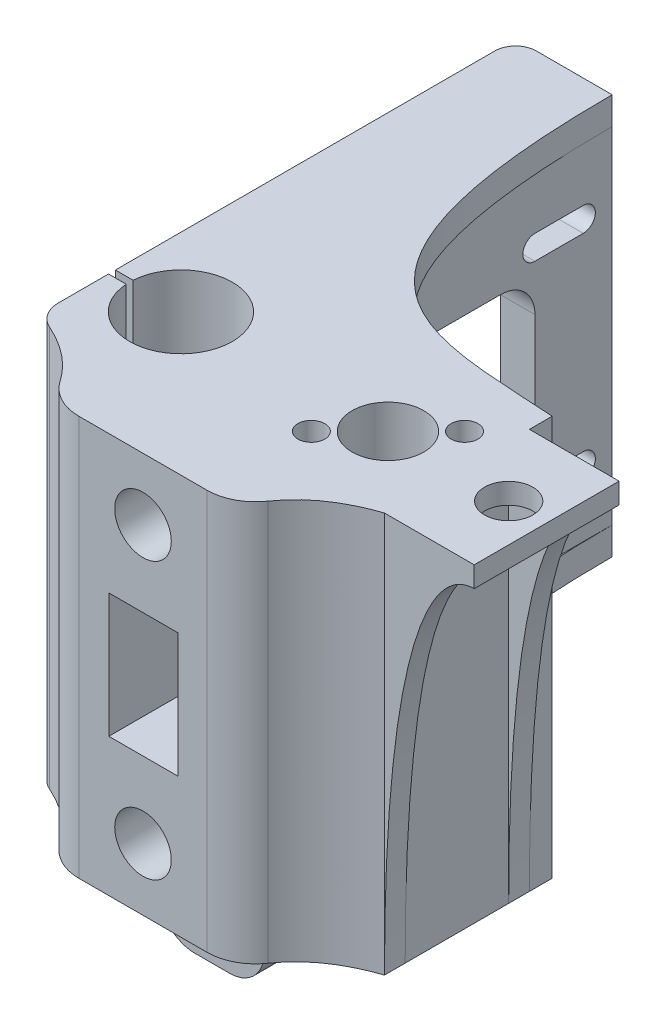
from build123d import *

# Parameters (mm, degrees)
SKETCH1_W                      = 50
SKETCH1_H                      = 21
BOSS_EXTRUDE1_DEPTH            = 58
SKETCH3_R                      = 7.45
CUT_EXTRUDE1_DEPTH             = 24
CUT_EXTRUDE2_REACH             = 66.025
SKETCH4_R                      = 5.2
CUT_EXTRUDE3_START             = -24
SKETCH5_R                      = 7.45
CUT_EXTRUDE3_DEPTH             = 24
CUT_EXTRUDE4_REACH             = 66.025
SKETCH6_R                      = 4.5
SKETCH9_W                      = 5
SKETCH9_H                      = 58
BOSS_EXTRUDE3_DEPTH            = 48
CUT_EXTRUDE7_REACH             = 94.018
BOSS_EXTRUDE4_START            = -4
BOSS_EXTRUDE4_DEPTH            = 4
SKETCH19_R                     = 1.95
CUT_EXTRUDE11_DEPTH            = 10
CUT_EXTRUDE12_DEPTH            = 87.088617298
CUT_EXTRUDE12_DEPTH_BACK       = 87.088617298
SKETCH20_W                     = 5.527864045
SKETCH20_H                     = 1
BOSS_EXTRUDE5_DEPTH            = 13
CUT_EXTRUDE13_START            = -21
CUT_EXTRUDE13_DEPTH            = 21
CUT_EXTRUDE14_REACH            = 90.833
SKETCH23_R                     = 3.5
BOSS_EXTRUDE7_DEPTH            = 11
CUT_EXTRUDE15_REACH            = 98.074
SKETCH26_R                     = 3.5
CUT_EXTRUDE16_DEPTH            = 15.1
SKETCH29_W                     = 50
SKETCH29_H                     = 58
BOSS_EXTRUDE8_DEPTH            = 10
CUT_EXTRUDE17_DEPTH            = 80
FILLET3_R                      = 7
FILLET5_R                      = 7
FILLET6_R                      = 4
SKETCH31_W                     = 36
SKETCH31_H                     = 50.133464381
BOSS_EXTRUDE9_DEPTH            = 3.31
CUT_EXTRUDE8_DEPTH             = 98.82126575
CUT_EXTRUDE8_DEPTH_BACK        = 21
SKETCH7_R                      = 4.1
CUT_EXTRUDE5_REACH             = 99.821
SKETCH8_W                      = 10
SKETCH8_H                      = 18
CUT_EXTRUDE5_DIRECTION_2_DEPTH = 98.82126575
FILLET7_R                      = 5


# Read off the part's stored shape, not the designer's step: Boss-Extrude4
with BuildPart() as part:
    # Sketch1 → Boss-Extrude1 (new body)
    with BuildSketch(Plane(origin=(0, 0, 0), x_dir=(1, 0, 0), z_dir=(0, 1, 0))):
        Rectangle(SKETCH1_W, SKETCH1_H)
    extrude(amount=BOSS_EXTRUDE1_DEPTH)

    # Sketch3 → Cut-Extrude1 (cut)
    with BuildSketch(Plane(origin=(0, 58, 0), x_dir=(1, 0, 0), z_dir=(0, 1, 0))):
        with Locations(Location((-15, 0, 0), (0, 0, 270))):
            Circle(SKETCH3_R)
    extrude(amount=-CUT_EXTRUDE1_DEPTH, mode=Mode.SUBTRACT)

    # Sketch4 → Cut-Extrude2 (cut, up to next)
    with BuildSketch(Plane(origin=(0, 58, 0), x_dir=(1, 0, 0), z_dir=(0, 1, 0)), mode=Mode.PRIVATE) as cut_extrude2_sk1:
        with Locations(Location((15, 0, 0), (0, 0, 270))):
            Circle(SKETCH4_R)
    cut_extrude2_tool1 = extrude(cut_extrude2_sk1.sketch, amount=-CUT_EXTRUDE2_REACH, mode=Mode.PRIVATE) & part.part
    add(cut_extrude2_tool1.solids().sort_by_distance((15, 58, 0))[0], mode=Mode.SUBTRACT)

    # Sketch5 → Cut-Extrude3 (cut)
    with BuildSketch(Plane.XZ.offset(CUT_EXTRUDE3_START)):
        with Locations(Location((-15, 0, 0), (0, 0, 90))):
            Circle(SKETCH5_R)
    extrude(amount=CUT_EXTRUDE3_DEPTH, mode=Mode.SUBTRACT)

    # Sketch6 → Cut-Extrude4 (cut, up to next)
    with BuildSketch(Plane.XZ, mode=Mode.PRIVATE) as cut_extrude4_sk1:
        with Locations(Location((-15, 0, 0), (0, 0, 270))):
            Circle(SKETCH6_R)
    cut_extrude4_tool1 = extrude(cut_extrude4_sk1.sketch, amount=-CUT_EXTRUDE4_REACH, mode=Mode.PRIVATE) & part.part
    add(cut_extrude4_tool1.solids().sort_by_distance((-15, 0, 0))[0], mode=Mode.SUBTRACT)

    # Sketch9 → Boss-Extrude3 (add)
    with BuildSketch(Plane(origin=(0, 0, -10.5), x_dir=(-1, 0, 0), z_dir=(0, 0, -1))):
        with Locations((13.5, 29)):
            Rectangle(SKETCH9_W, SKETCH9_H)
    extrude(amount=BOSS_EXTRUDE3_DEPTH)

    # Sketch10 → Cut-Extrude7 (cut, up to next)
    with BuildSketch(Plane.ZY.offset(16), mode=Mode.PRIVATE) as cut_extrude7_sk1:
        with BuildLine():
            Line((-47.310698145, 46.2), (-54.310698145, 46.2))
            ThreePointArc((-54.310698145, 46.2), (-56.060698145, 44.45), (-54.310698145, 42.7))
            Line((-54.310698145, 42.7), (-47.310698145, 42.7))
            ThreePointArc((-47.310698145, 42.7), (-45.560698145, 44.45), (-47.310698145, 46.2))
        make_face()
    cut_extrude7_tool1 = extrude(cut_extrude7_sk1.sketch, amount=-CUT_EXTRUDE7_REACH, mode=Mode.PRIVATE) & part.part
    # Sketch10 → Cut-Extrude7 (cut, up to next)
    with BuildSketch(Plane.ZY.offset(16), mode=Mode.PRIVATE) as cut_extrude7_sk2:
        with BuildLine():
            Line((-42.310698145, 17), (-28.310698145, 17))
            ThreePointArc((-28.310698145, 17), (-24.775164239, 18.464466094), (-23.310698145, 22))
            Line((-23.310698145, 22), (-23.310698145, 36))
            ThreePointArc((-23.310698145, 36), (-24.775164239, 39.535533906), (-28.310698145, 41))
            Line((-28.310698145, 41), (-42.310698145, 41))
            ThreePointArc((-42.310698145, 41), (-45.84623205, 39.535533906), (-47.310698145, 36))
            Line((-47.310698145, 36), (-47.310698145, 22))
            ThreePointArc((-47.310698145, 22), (-45.84623205, 18.464466094), (-42.310698145, 17))
        make_face()
    cut_extrude7_tool2 = extrude(cut_extrude7_sk2.sketch, amount=-CUT_EXTRUDE7_REACH, mode=Mode.PRIVATE) & part.part
    # Sketch10 → Cut-Extrude7 (cut, up to next)
    with BuildSketch(Plane.ZY.offset(16), mode=Mode.PRIVATE) as cut_extrude7_sk3:
        with BuildLine():
            Line((-16.310698145, 15.3), (-23.310698145, 15.3))
            ThreePointArc((-23.310698145, 15.3), (-25.060698145, 13.55), (-23.310698145, 11.8))
            Line((-23.310698145, 11.8), (-16.310698145, 11.8))
            ThreePointArc((-16.310698145, 11.8), (-14.560698145, 13.55), (-16.310698145, 15.3))
        make_face()
    cut_extrude7_tool3 = extrude(cut_extrude7_sk3.sketch, amount=-CUT_EXTRUDE7_REACH, mode=Mode.PRIVATE) & part.part
    # Sketch10 → Cut-Extrude7 (cut, up to next)
    with BuildSketch(Plane.ZY.offset(16), mode=Mode.PRIVATE) as cut_extrude7_sk4:
        with BuildLine():
            Line((-47.310698145, 11.8), (-54.310698145, 11.8))
            ThreePointArc((-54.310698145, 11.8), (-56.060698145, 13.55), (-54.310698145, 15.3))
            Line((-54.310698145, 15.3), (-47.310698145, 15.3))
            ThreePointArc((-47.310698145, 15.3), (-45.560698145, 13.55), (-47.310698145, 11.8))
        make_face()
    cut_extrude7_tool4 = extrude(cut_extrude7_sk4.sketch, amount=-CUT_EXTRUDE7_REACH, mode=Mode.PRIVATE) & part.part
    # Sketch10 → Cut-Extrude7 (cut, up to next)
    with BuildSketch(Plane.ZY.offset(16), mode=Mode.PRIVATE) as cut_extrude7_sk5:
        with BuildLine():
            Line((-16.310698145, 46.2), (-23.310698145, 46.2))
            ThreePointArc((-23.310698145, 46.2), (-25.060698145, 44.45), (-23.310698145, 42.7))
            Line((-23.310698145, 42.7), (-16.310698145, 42.7))
            ThreePointArc((-16.310698145, 42.7), (-14.560698145, 44.45), (-16.310698145, 46.2))
        make_face()
    cut_extrude7_tool5 = extrude(cut_extrude7_sk5.sketch, amount=-CUT_EXTRUDE7_REACH, mode=Mode.PRIVATE) & part.part
    add(cut_extrude7_tool1.solids().sort_by_distance((-16, 44.45, -50.810698))[0], mode=Mode.SUBTRACT)
    add(cut_extrude7_tool2.solids().sort_by_distance((-16, 29, -35.310698))[0], mode=Mode.SUBTRACT)
    add(cut_extrude7_tool3.solids().sort_by_distance((-16, 13.55, -19.810698))[0], mode=Mode.SUBTRACT)
    add(cut_extrude7_tool4.solids().sort_by_distance((-16, 13.55, -50.810698))[0], mode=Mode.SUBTRACT)
    add(cut_extrude7_tool5.solids().sort_by_distance((-16, 44.45, -19.810698))[0], mode=Mode.SUBTRACT)

    # Boss-Extrude4 outline → Boss-Extrude4 (add)
    with BuildSketch(Plane(origin=(0, 0, 0), x_dir=(-1, 0, 0), z_dir=(0, -1, 0)).offset(BOSS_EXTRUDE4_START)):
        with BuildLine():
            Line((11, 10.5), (11, 58.5))
            add(Edge.make_bspline(
                [(11, 58.5), (11.009460691, 13.119942058), (-4.502737222, 15.119341911), (-25, 13.805693573)],
                knots=[0, 0, 0, 0, 1, 1, 1, 1], degree=3))
            Line((-25, 13.805693573), (-25, 10.5))
            Line((-25, 10.5), (11, 10.5))
        make_face()
        with BuildLine():
            Line((22, 58.5), (16, 58.5))
            Line((16, 58.5), (16, 10.5))
            Line((16, 10.5), (25, 10.5))
            Line((25, 10.5), (25, 55.5))
            ThreePointArc((25, 55.5), (24.121320344, 57.621320344), (22, 58.5))
        make_face()
    boss_extrude4 = extrude(amount=BOSS_EXTRUDE4_DEPTH)

    # Mirror1: Boss-Extrude4 across plane
    add(boss_extrude4.mirror(Plane(origin=(0, 29, 0), x_dir=(0, 0, 1), z_dir=(0, -1, 0))))

    # Sketch19 → Cut-Extrude11 (cut)
    with BuildSketch(Plane(origin=(0, 58, 0), x_dir=(1, 0, 0), z_dir=(0, 1, 0))):
        with Locations(Location((20.550788232, 5.550788232, 0), (0, 0, 270))):
            Circle(SKETCH19_R)
        with Locations(Location((9.449211768, -5.550788232, 0), (0, 0, 270))):
            Circle(SKETCH19_R)
    extrude(amount=-CUT_EXTRUDE11_DEPTH, mode=Mode.SUBTRACT)

    # Sketch20 → Cut-Extrude12 (cut, two sides: drawn at the far end of the back side and taken through both)
    with BuildSketch(Plane.XZ.offset(-CUT_EXTRUDE12_DEPTH_BACK)):
        with Locations((-22.236067977, 0)):
            Rectangle(SKETCH20_W, SKETCH20_H)
    extrude(amount=CUT_EXTRUDE12_DEPTH + CUT_EXTRUDE12_DEPTH_BACK, mode=Mode.SUBTRACT)

    # Sketch21 → Boss-Extrude5 (add)
    with BuildSketch(Plane(origin=(25, 0, 0), x_dir=(0, 0, -1), z_dir=(1, 0, 0))):
        Polygon((10.5, 0), (10.5, 58), (-10.5, 58), (-10.5, 0), (-7.5, 0), (-7.5, 55), (7.5, 55), (7.5, 0), align=None)
    extrude(amount=BOSS_EXTRUDE5_DEPTH)

    # Sketch22 → Cut-Extrude13 (cut)
    with BuildSketch(Plane.XY.offset(10.5).offset(CUT_EXTRUDE13_START)):
        with BuildLine():
            Line((25, 0), (38, 0))
            Line((38, 0), (38, 55))
            add(Edge.make_bspline(
                [(38, 55), (31.45567161, 55), (25, 40.968536323), (25, 0)],
                knots=[0, 0, 0, 0, 1, 1, 1, 1], degree=3))
        make_face()
    extrude(amount=CUT_EXTRUDE13_DEPTH, mode=Mode.SUBTRACT)

    # Sketch23 → Cut-Extrude14 (cut, up to next)
    with BuildSketch(Plane.XZ.offset(-55), mode=Mode.PRIVATE) as cut_extrude14_sk1:
        with Locations(Location((32.5, 0, 0), (0, 0, 270))):
            Circle(SKETCH23_R)
    cut_extrude14_tool1 = extrude(cut_extrude14_sk1.sketch, amount=-CUT_EXTRUDE14_REACH, mode=Mode.PRIVATE) & part.part
    add(cut_extrude14_tool1.solids().sort_by_distance((32.5, 55, 0))[0], mode=Mode.SUBTRACT)

    # Sketch24 → Boss-Extrude7 (add)
    with BuildSketch(Plane.XZ):
        Polygon((7.55, 10.5), (7.55, -15.617697267), (5.05, -15.617697267), (5.05, 8), (-5.05, 8), (-5.05, -15.617697267), (-7.55, -15.617697267), (-7.55, 10.5), align=None)
    extrude(amount=BOSS_EXTRUDE7_DEPTH)

    # Sketch26 → Cut-Extrude15 (cut, up to next)
    with BuildSketch(Plane(origin=(0, 0, 8), x_dir=(-1, 0, 0), z_dir=(0, 0, -1)), mode=Mode.PRIVATE) as cut_extrude15_sk1:
        with Locations((0, -5.5)):
            Circle(SKETCH26_R)
    cut_extrude15_tool1 = extrude(cut_extrude15_sk1.sketch, amount=-CUT_EXTRUDE15_REACH, mode=Mode.PRIVATE) & part.part
    add(cut_extrude15_tool1.solids().sort_by_distance((0, -5.5, 8))[0], mode=Mode.SUBTRACT)

    # Sketch27 → Cut-Extrude16 (cut)
    with BuildSketch(Plane.ZY.offset(7.55)):
        with BuildLine():
            Line((8, -11), (-15.617697267, -11))
            Line((-15.617697267, -11), (-15.617697267, 0))
            add(Edge.make_bspline(
                [(8, -11), (8, -5.603660731), (-2.854504572, 0), (-15.617697267, 0)],
                knots=[0, 0, 0, 0, 1, 1, 1, 1], degree=3))
        make_face()
    extrude(amount=-CUT_EXTRUDE16_DEPTH, mode=Mode.SUBTRACT)

    # Sketch29 → Boss-Extrude8 (add)
    with BuildSketch(Plane.XY.offset(10.5)):
        with Locations((0, 29)):
            Rectangle(SKETCH29_W, SKETCH29_H)
    extrude(amount=BOSS_EXTRUDE8_DEPTH)

    # Sketch30 → Cut-Extrude17 (cut)
    with BuildSketch(Plane.XZ):
        with BuildLine():
            Line((25, 10.5), (25, 20.5))
            Line((25, 20.5), (13.424901186, 20.5))
            add(Edge.make_bspline(
                [(25, 10.5), (16.30265807, 13.413799082), (13.424901186, 20.5)],
                knots=[0, 0, 0, 1, 1, 1], degree=2))
        make_face()
        with BuildLine():
            Line((-13.424901186, 20.5), (-25, 20.5))
            Line((-25, 20.5), (-25, 10.5))
            add(Edge.make_bspline(
                [(-25, 10.5), (-16.30265807, 13.413799082), (-13.424901186, 20.5)],
                knots=[0, 0, 0, 1, 1, 1], degree=2))
        make_face()
    extrude(amount=-CUT_EXTRUDE17_DEPTH, mode=Mode.SUBTRACT)

    # Fillet3
    fillet3_edges = [part.edges().sort_by_distance(p)[0] for p in [
        (13.424901186, 29, 20.5),
    ]]
    fillet(fillet3_edges, radius=FILLET3_R)

    # Fillet5
    fillet5_edges = [part.edges().sort_by_distance(p)[0] for p in [
        (-13.424901186, 29, 20.5),
    ]]
    fillet(fillet5_edges, radius=FILLET5_R)

    # Fillet6
    fillet6_edges = [part.edges().sort_by_distance(p)[0] for p in [
        (-25, 29, 10.5),
    ]]
    fillet(fillet6_edges, radius=FILLET6_R)

    # Sketch31 → Boss-Extrude9 (add)
    with BuildSketch(Plane(origin=(0, 0, -10.5), x_dir=(-1, 0, 0), z_dir=(0, 0, -1))):
        with Locations((-7, 29.066732191)):
            Rectangle(SKETCH31_W, SKETCH31_H)
    extrude(amount=BOSS_EXTRUDE9_DEPTH)

    # Sketch7 → Cut-Extrude8 (cut, two sides: drawn at the far end of the back side and taken through both)
    with BuildSketch(Plane.XY.offset(10.5).offset(-CUT_EXTRUDE8_DEPTH_BACK)):
        with Locations((0, 49)):
            Circle(SKETCH7_R)
        with Locations(Location((0, 9, 0), (0, 0, 180))):
            Circle(SKETCH7_R)
    extrude(amount=CUT_EXTRUDE8_DEPTH + CUT_EXTRUDE8_DEPTH_BACK, mode=Mode.SUBTRACT)

    # Sketch8 → Cut-Extrude5 (cut, up to next)
    with BuildSketch(Plane.XY.offset(10.5), mode=Mode.PRIVATE) as cut_extrude5_sk1:
        with Locations((0.05, 29)):
            Rectangle(SKETCH8_W, SKETCH8_H)
    cut_extrude5_tool1 = extrude(cut_extrude5_sk1.sketch, amount=-CUT_EXTRUDE5_REACH, mode=Mode.PRIVATE) & part.part
    add(cut_extrude5_tool1.solids().sort_by_distance((0.05, 29, 10.5))[0], mode=Mode.SUBTRACT)

    # Sketch8 → Cut-Extrude5 direction 2 (cut)
    with BuildSketch(Plane.XY.offset(10.5)):
        with Locations((0.05, 29)):
            Rectangle(SKETCH8_W, SKETCH8_H)
    extrude(amount=CUT_EXTRUDE5_DIRECTION_2_DEPTH, mode=Mode.SUBTRACT)

    # Fillet7
    # the kernel refuses this fillet: 5 mm, written as the material it takes off along each edge
    with BuildSketch(Plane(origin=(7.55, -11, 23), x_dir=(-1, 0, 0), z_dir=(0, 0, -1)), Plane(origin=(-7.55, -11, -4.5), x_dir=(1, 0, 0), z_dir=(0, 0, 1))) as fillet7_piece_1:
        with BuildLine():
            CenterArc((FILLET7_R, FILLET7_R), FILLET7_R, 180, 90)
            Line((0, FILLET7_R), (0, 0))
            Line((0, 0), (FILLET7_R, 0))
        make_face()
    extrude(amount=27.5, mode=Mode.SUBTRACT)


solid = part.part
